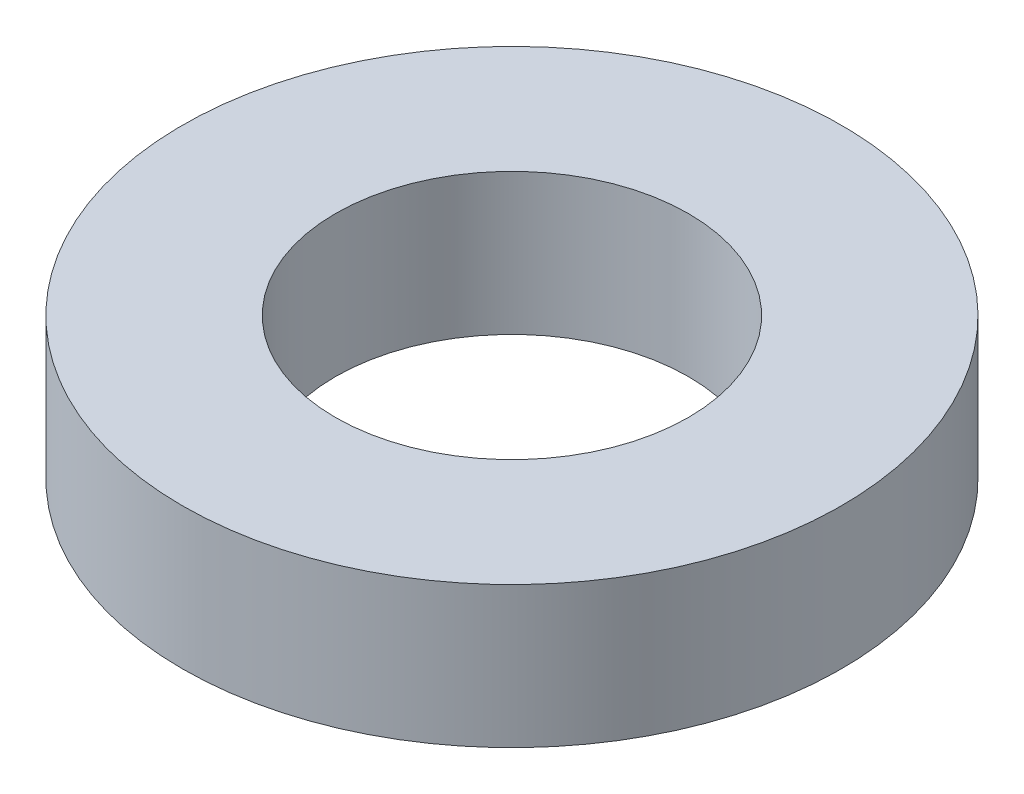
from build123d import *

# Parameters (mm, degrees)
SKETCH1_R           = 70
BOSS_EXTRUDE1_DEPTH = 30
SKETCH2_R           = 37.5
CUT_EXTRUDE1_DEPTH  = 104.440804328


with BuildPart() as part:
    # Sketch1 → Boss-Extrude1 (new body)
    with BuildSketch(Plane(origin=(0, 0, 0), x_dir=(1, 0, 0), z_dir=(0, 1, 0))):
        Circle(SKETCH1_R)
    extrude(amount=BOSS_EXTRUDE1_DEPTH)

    # Sketch2 → Cut-Extrude1 (cut, through all)
    with BuildSketch(Plane(origin=(0, 0, 0), x_dir=(1, 0, 0), z_dir=(0, 1, 0))):
        Circle(SKETCH2_R)
    extrude(amount=CUT_EXTRUDE1_DEPTH, mode=Mode.SUBTRACT)


solid = part.part
